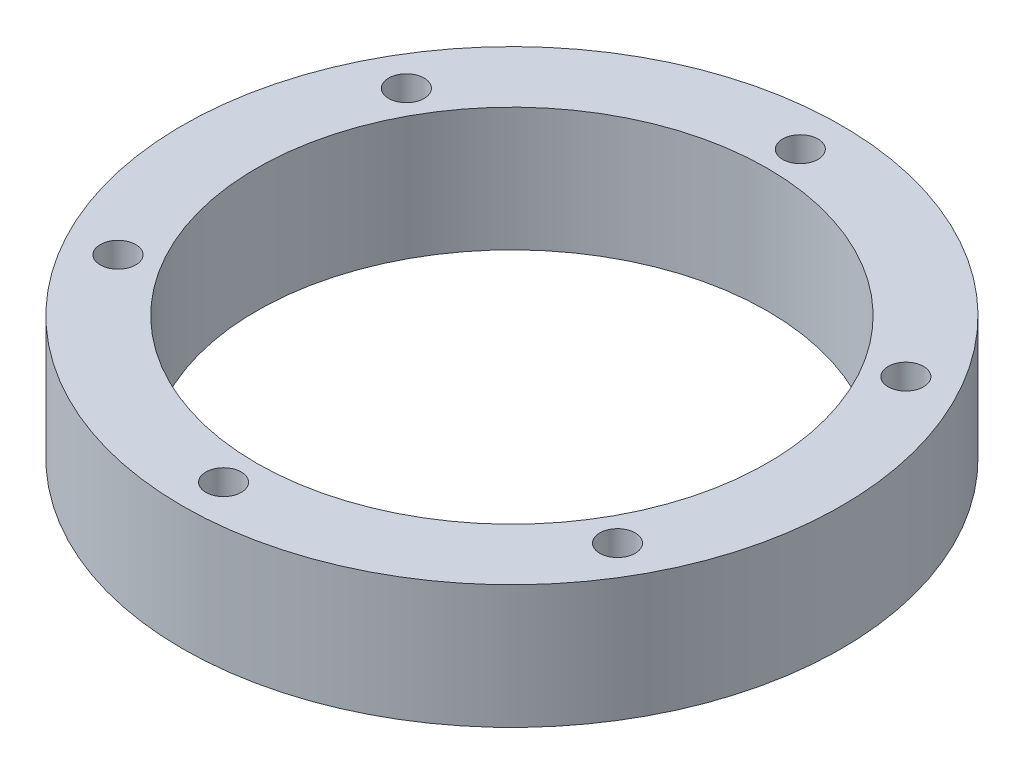
from build123d import *

# Parameters (mm, degrees)
SKETCH_1_R      = 40
SKETCH_1_R_2    = 2.15
SKETCH_1_R_3    = 31
EXTRUDE_3_DEPTH = 15


with BuildPart() as part:
    # 草图1 → 凸台-拉伸3 (new body)
    with BuildSketch(Plane(origin=(0, 0, 0), x_dir=(1, 0, 0), z_dir=(0, 1, 0))):
        Circle(SKETCH_1_R)
        with Locations((30.310889132, -17.5)):
            Circle(SKETCH_1_R_2, mode=Mode.SUBTRACT)
        with Locations((0, -35)):
            Circle(SKETCH_1_R_2, mode=Mode.SUBTRACT)
        with Locations((-30.310889132, -17.5)):
            Circle(SKETCH_1_R_2, mode=Mode.SUBTRACT)
        with Locations((-30.310889132, 17.5)):
            Circle(SKETCH_1_R_2, mode=Mode.SUBTRACT)
        with Locations((0, 35)):
            Circle(SKETCH_1_R_2, mode=Mode.SUBTRACT)
        with Locations((30.310889132, 17.5)):
            Circle(SKETCH_1_R_2, mode=Mode.SUBTRACT)
        Circle(SKETCH_1_R_3, mode=Mode.SUBTRACT)
    extrude(amount=EXTRUDE_3_DEPTH)


solid = part.part
